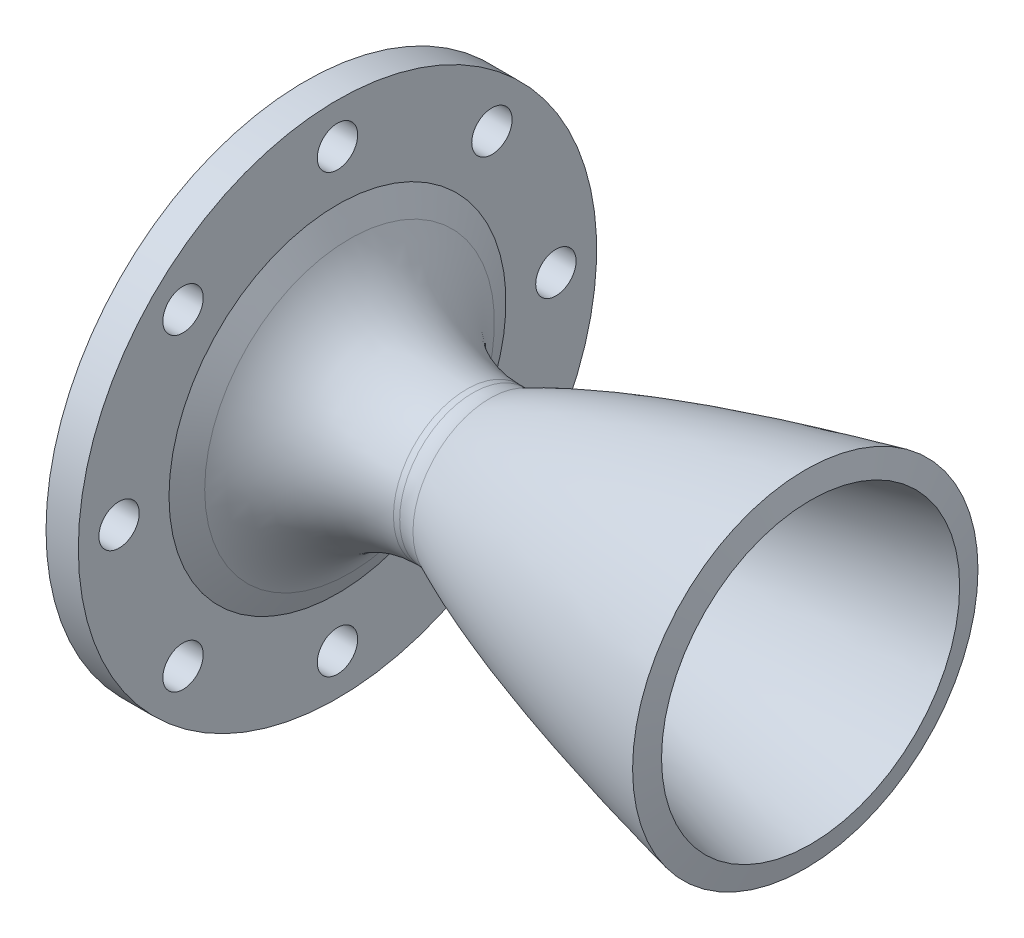
from build123d import *

# Parameters (mm, degrees)
CUT_EXTRUDE1_DEPTH      = 79.383218534
CUT_EXTRUDE1_DEPTH_BACK = 79.383218534
SKETCH2_R               = 2.5
FILLET4_R               = 5


with BuildPart() as part:
    # Sketch1 → Revolve1 (revolve)
    with BuildSketch(Plane.XY):
        with BuildLine():
            Line((-11.262843719, 8.545166649), (-13.867494262, 8.545166649))
            ThreePointArc((-13.867494262, 8.545166649), (-23.934757609, 11.380312297), (-31.042965431, 19.052419161))
            Line((-31.042965431, 19.052419161), (-33.867494262, 24.575166649))
            Line((-33.867494262, 24.575166649), (-33.867494262, 34.575166649))
            Line((-33.867494262, 34.575166649), (-29.867494262, 34.575166649))
            Line((-29.867494262, 34.575166649), (-29.867494262, 23.342526126))
            Line((-29.867494262, 23.342526126), (-28.372012532, 20.418439151))
            ThreePointArc((-28.372012532, 20.418439151), (-22.369200196, 13.939419561), (-13.867494262, 11.545166649))
            Line((-13.867494262, 11.545166649), (-11.962582464, 11.545166649))
            add(Edge.make_bspline(
                [(28.070004148, 23.865673144), (27.883860949, 23.823890615), (27.536295913, 23.745576732), (26.86719613, 23.594037609), (26.14545853, 23.429761243), (25.505743024, 23.282936389), (24.939210749, 23.151587731), (24.269719306, 22.996187214), (23.631845183, 22.846809436), (22.814394965, 22.653795903), (21.739594628, 22.397965448), (20.067660859, 21.993659344), (15.42895989, 20.847693823), (7.8858505, 18.836973541), (-0.450198047, 16.233415129), (-6.23354237, 14.071844608), (-9.099238332, 12.867709494), (-10.533531465, 12.22197596), (-11.33857855, 11.845877638), (-11.756457136, 11.645619326), (-11.962582464, 11.545166649)],
                knots=[0.097288863, 0.097288863, 0.097288863, 0.097288863, 0.110120228, 0.122951594, 0.135782959, 0.148614325, 0.161445691, 0.174277056, 0.187108422, 0.199939787, 0.225602518, 0.251265249, 0.302590712, 0.507892561, 0.71319441, 0.815845334, 0.867170797, 0.892833528, 0.905664893, 0.918496259, 0.918496259, 0.918496259, 0.918496259], degree=3))
            Line((28.070004148, 23.865673144), (28.727048524, 20.938508528))
            add(Edge.make_bspline(
                [(-11.262843719, 8.545166649), (-11.170441059, 8.591462343), (-10.984487803, 8.683811463), (-10.575489565, 8.885115028), (-10.154061558, 9.086907571), (-9.679747924, 9.310185666), (-9.184137148, 9.538599437), (-8.63042617, 9.788430167), (-8.017732387, 10.058504817), (-7.198621917, 10.410985468), (-6.170221998, 10.839243724), (-4.963820191, 11.322736979), (-3.577298823, 11.855432034), (-2.145815673, 12.384283996), (-0.358215929, 13.020199562), (1.790147606, 13.749542713), (4.303011496, 14.558941178), (7.144742063, 15.425198855), (9.997609489, 16.252618229), (12.50287434, 16.946902246), (14.654490637, 17.52287688), (16.451960417, 17.991537193), (17.889144556, 18.359288831), (19.333055985, 18.721909175), (20.768930448, 19.076414029), (22.042482745, 19.385200619), (23.108789003, 19.640613616), (24.040774196, 19.860893008), (24.707626426, 20.01809099), (25.728516212, 20.254983426), (26.575325659, 20.451762799), (27.806977956, 20.731202234), (28.424522735, 20.870602246), (28.727048524, 20.938508528)],
                knots=[0.083499655, 0.083499655, 0.083499655, 0.083499655, 0.083499655, 0.093353561, 0.103207466, 0.113061323, 0.122915181, 0.134784596, 0.14665401, 0.161434815, 0.176215619, 0.205777188, 0.235338798, 0.264900393, 0.294461996, 0.327264292, 0.386387484, 0.445510682, 0.504633878, 0.563757077, 0.622880274, 0.652441873, 0.682003472, 0.71156507, 0.741126669, 0.770688268, 0.800249866, 0.815030665, 0.829811465, 0.844592264, 0.859373063, 0.888934661, 0.918496259, 0.918496259, 0.918496259, 0.918496259, 0.918496259], degree=4))
        make_face()
    revolve(axis=Axis((-40.101785927, 2.475166649, 0), (1, 0, 0)))

    # Sketch2 → Cut-Extrude1 (cut, two sides: drawn at the far end of the back side and taken through both)
    with BuildSketch(Plane.ZY.offset(33.867494262).offset(-CUT_EXTRUDE1_DEPTH_BACK)):
        with Locations((0, 29.575166649)):
            Circle(SKETCH2_R)
        with Locations((-19.127858888, 21.652148078)):
            Circle(SKETCH2_R)
        with Locations((-27.050877458, 2.524289191)):
            Circle(SKETCH2_R)
        with Locations((-19.127858888, -16.603569697)):
            Circle(SKETCH2_R)
        with Locations((0, -24.526588267)):
            Circle(SKETCH2_R)
        with Locations((19.127858888, -16.603569697)):
            Circle(SKETCH2_R)
        with Locations((27.050877458, 2.524289191)):
            Circle(SKETCH2_R)
        with Locations((19.127858888, 21.652148078)):
            Circle(SKETCH2_R)
    extrude(amount=CUT_EXTRUDE1_DEPTH + CUT_EXTRUDE1_DEPTH_BACK, mode=Mode.SUBTRACT)

    # Fillet4
    fillet4_edges = [part.edges().sort_by_distance(p)[0] for p in [
        (-11.962582464, -6.594833351, 0),
    ]]
    fillet(fillet4_edges, radius=FILLET4_R)


solid = part.part
